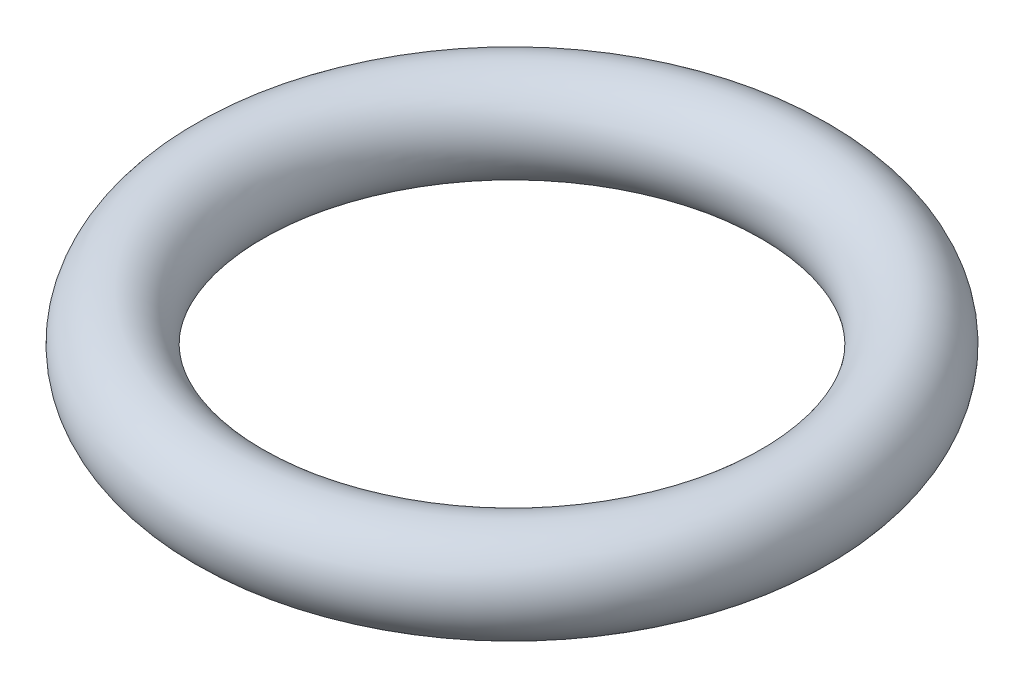
from build123d import *

# Parameters (mm, degrees)
SKETCH1_R = 25.4


with BuildPart() as part:
    # Sketch1 → Revolve1 (revolve)
    with BuildSketch(Plane(origin=(0, 0, 0), x_dir=(0, 0, -1), z_dir=(1, 0, 0))):
        with Locations((-152.4, 25.4)):
            Circle(SKETCH1_R)
    revolve(axis=Axis((0, -77.331101162, 0), (0, 1, 0)))


solid = part.part
